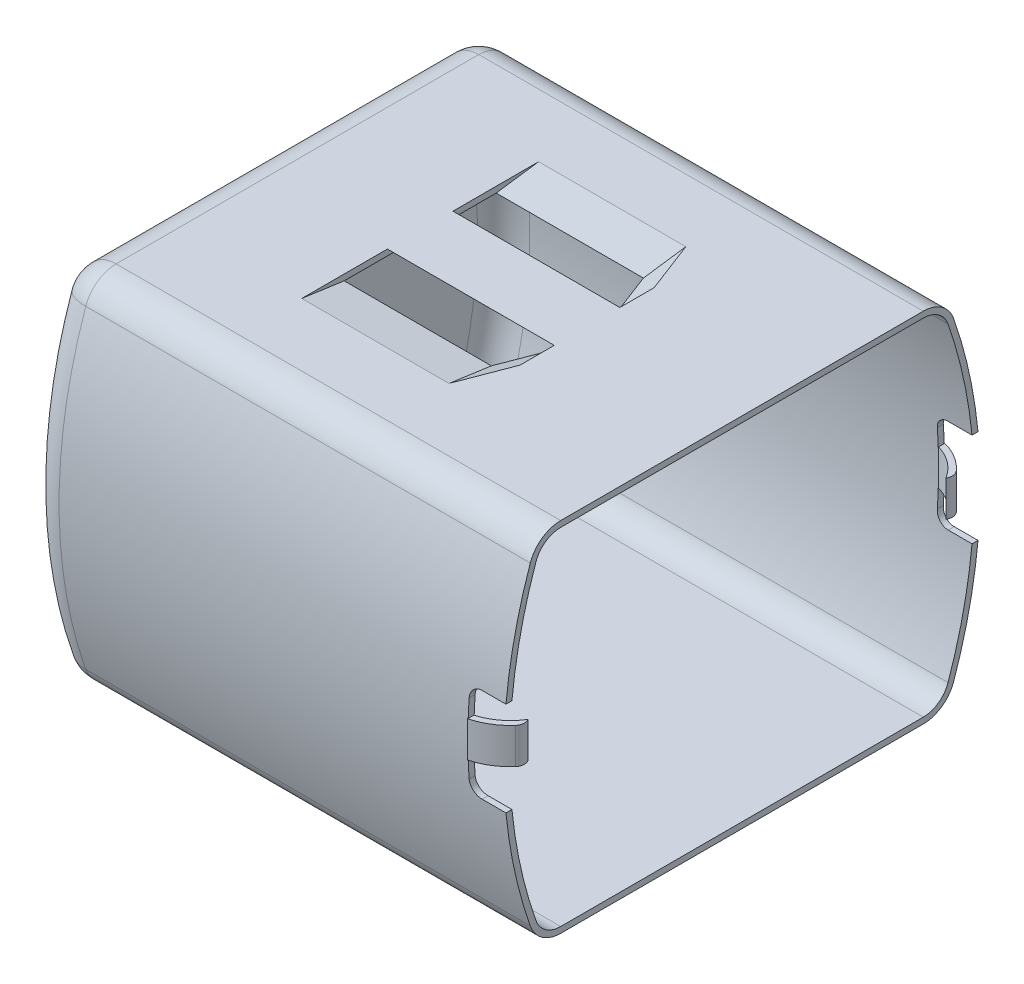
from build123d import *

# Parameters (mm, degrees)
BOSS_EXTRUDE1_DEPTH       = 10
SKETCH2_R                 = 3
BOSS_EXTRUDE3_DEPTH       = 1
FILLET2_R                 = 1.35
SHELL6_T                  = -0.25
SHELL6_THICKNESS_2_FACE_R = 2.75
SHELL6_THICKNESS_2_DEPTH  = 1
SKETCH3_R                 = 1
CUT_EXTRUDE2_DEPTH        = 25.438698861
CUT_EXTRUDE6_DEPTH        = 10
CUT_EXTRUDE9_DEPTH        = 17.650825865
CUT_EXTRUDE9_DEPTH_BACK   = 17.650825865
BOSS_EXTRUDE4_DEPTH       = 0.75
FILLET3_R                 = 0.4
FILLET3_OF_MIRROR2_R      = 0.4


with BuildPart() as part:
    # Sketch1 → Boss-Extrude1 (new, symmetric)
    with BuildSketch(Plane(origin=(0, 0, 0), x_dir=(0, 0, -1), z_dir=(1, 0, 0))):
        with BuildLine():
            Line((-8.540496218, -7.5), (8.540496218, -7.5))
            ThreePointArc((8.540496218, -7.5), (10, 0), (8.540496218, 7.5))
            Line((8.540496218, 7.5), (-8.540496218, 7.5))
            ThreePointArc((-8.540496218, 7.5), (-10, 0), (-8.540496218, -7.5))
        make_face()
    extrude(amount=BOSS_EXTRUDE1_DEPTH, both=True)

    # Sketch2 → Boss-Extrude3 (add)
    with BuildSketch(Plane.ZY.offset(10)):
        Circle(SKETCH2_R)
    extrude(amount=BOSS_EXTRUDE3_DEPTH)

    # Fillet2
    fillet2_edges = [part.edges().sort_by_distance(p)[0] for p in [
        (-10, -7.5, 0),
        (-10, 0, 10),
        (-10, 7.5, 0),
        (-10, 0, -10),
        (0, -7.5, -8.540496218),
        (0, -7.5, 8.540496218),
        (0, 7.5, 8.540496218),
        (0, 7.5, -8.540496218),
    ]]
    fillet(fillet2_edges, radius=FILLET2_R)

    # Shell6
    shell6_openings = [part.faces().sort_by_distance(p)[0] for p in [
        (10, 0, 0),
    ]]
    offset(amount=SHELL6_T, openings=shell6_openings, kind=Kind.INTERSECTION)

    # Shell6 thickness 2 face (on inner face of the shell) → Shell6 thickness 2 (add)
    with BuildSketch(Plane(origin=(-10.75, 0, 0), x_dir=(0, 0, -1), z_dir=(-1, 0, 0))):
        Circle(SHELL6_THICKNESS_2_FACE_R)
    extrude(amount=-SHELL6_THICKNESS_2_DEPTH)

    # Sketch3 → Cut-Extrude2 (cut, through all)
    with BuildSketch(Plane.ZY.offset(11)):
        Circle(SKETCH3_R)
    extrude(amount=-CUT_EXTRUDE2_DEPTH, mode=Mode.SUBTRACT)

    # Sketch8 → Cut-Extrude6 (cut)
    with BuildSketch(Plane(origin=(0, 1.317628396, 9.375413194), x_dir=(-1, 0, 0), z_dir=(0, -0.13917310096005872, -0.9902680687415713))):
        Polygon((3.5, 6.735543413), (3.5, 7.235543413), (-3.5, 7.235543413), (-3.5, 7.035543413), (-2.675756774, 6.735543413), align=None)
    cut_extrude6 = extrude(amount=CUT_EXTRUDE6_DEPTH, mode=Mode.SUBTRACT)

    # Mirror1: Cut-Extrude6 across plane
    add(cut_extrude6.mirror(Plane.XY), mode=Mode.SUBTRACT)

    # Sketch9 → Cut-Extrude9 (cut, two sides: drawn at the far end of the back side and taken through both)
    with BuildSketch(Plane.XY.offset(-CUT_EXTRUDE9_DEPTH_BACK)):
        with BuildLine():
            Line((10, 1.975), (9, 1.975))
            ThreePointArc((9, 1.975), (8.646446609, 1.828553391), (8.5, 1.475))
            Line((8.5, 1.475), (8.5, -1.475))
            ThreePointArc((8.5, -1.475), (8.646446609, -1.828553391), (9, -1.975))
            Line((9, -1.975), (10, -1.975))
            Line((10, -1.975), (10, 1.975))
        make_face()
    extrude(amount=CUT_EXTRUDE9_DEPTH + CUT_EXTRUDE9_DEPTH_BACK, mode=Mode.SUBTRACT)

    # Sketch10 → Boss-Extrude4 (add, symmetric)
    with BuildSketch(Plane(origin=(0, 0, 0), x_dir=(1, 0, 0), z_dir=(0, 1, 0))):
        with BuildLine():
            Line((9.787254425, 8.770946884), (10, 8.902245476))
            ThreePointArc((10, 8.902245476), (9.357045131, 9.600790595), (8.5, 10.009238743))
            Line((8.5, 10.009238743), (8.5, 9.75))
            ThreePointArc((8.5, 9.75), (9.234633876, 9.380128574), (9.787254425, 8.770946884))
        make_face()
    boss_extrude4 = extrude(amount=BOSS_EXTRUDE4_DEPTH, both=True)

    # Fillet3
    # the kernel refuses this fillet: 0.4 mm, written as the material it takes off along each edge
    with BuildSketch(Plane(origin=(10, -1.816179824, -8.902245476), x_dir=(-0.5958644657963694, 0, -0.8030850131842876), z_dir=(0, 1, 0))) as fillet3_piece_1:
        with BuildLine():
            CenterArc((0.392354175, 0.398542317), FILLET3_R, 201.939875172, 72.953078249)
            Line((0.021323596, 0.249088948), (0.013902985, 0.246099881))
            ThreePointArc((0.013902985, 0.246099881), (0.002690952, 0.125226829), (-0.007970846, 0.000682355))
            Line((-0.007970846, 0.000682355), (-0.000682355, -0.007970846))
            ThreePointArc((-0.000682355, -0.007970846), (0.213235965, -0.017110516), (0.427154285, -0.007970846))
            Line((0.427154285, -0.007970846), (0.42647193, 0))
        make_face()
    extrude(amount=3.632359649, mode=Mode.SUBTRACT)

    # Mirror2: Boss-Extrude4 across plane
    add(boss_extrude4.mirror(Plane.XY))

    # Fillet3 of Mirror2
    # the kernel refuses this fillet: 0.4 mm, written as the material it takes off along each edge
    with BuildSketch(Plane(origin=(10, -1.816179824, 8.902245476), x_dir=(-0.5958644657963694, 0, 0.8030850131842876), z_dir=(0, 1, 0))) as fillet3_of_mirror2_piece_1:
        with BuildLine():
            CenterArc((0.392354175, -0.398542317), FILLET3_OF_MIRROR2_R, 85.10704658, 72.953078249)
            Line((0.021323596, -0.249088948), (0.013902985, -0.246099881))
            ThreePointArc((0.013902985, -0.246099881), (0.002690952, -0.125226829), (-0.007970846, -0.000682355))
            Line((-0.007970846, -0.000682355), (-0.000682355, 0.007970846))
            ThreePointArc((-0.000682355, 0.007970846), (0.213235965, 0.017110516), (0.427154285, 0.007970846))
            Line((0.427154285, 0.007970846), (0.42647193, 0))
        make_face()
    extrude(amount=3.632359649, mode=Mode.SUBTRACT)


solid = part.part
